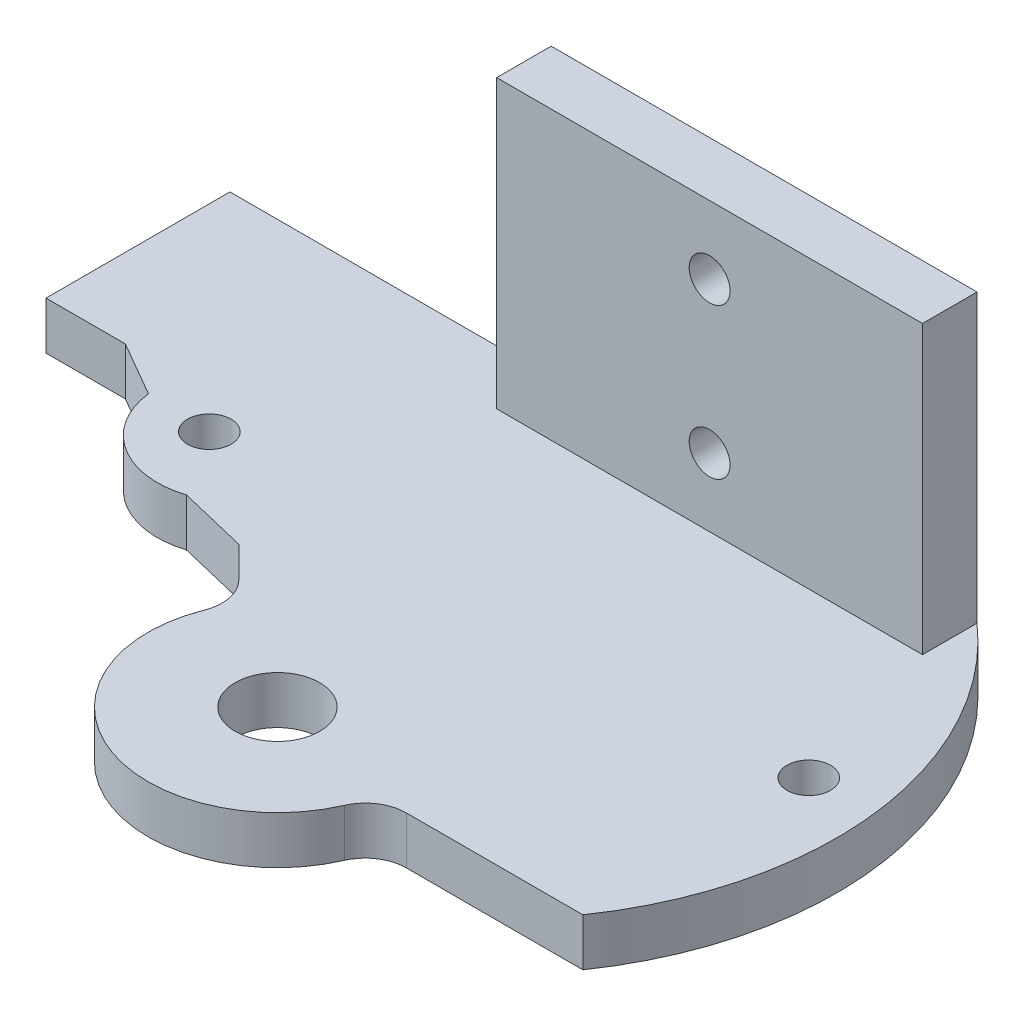
from build123d import *
from build123d.topology import SkipClean

# Parameters (mm, degrees)
CROQUIS1_W              = 70
CROQUIS1_H              = 65
EXTRUIR1_DEPTH          = 3.5
CROQUIS2_R              = 3.1
EXTRUIR2_DEPTH          = 5
EXTRUIR3_DEPTH          = 10
CROQUIS4_OUTSIDE_W      = 91.294
CROQUIS4_OUTSIDE_H      = 86.294
EXTRUIR4_DEPTH          = 10
REDONDEO1_R             = 3
EXTRUIR5_DEPTH          = 13.5
EXTRUIR6_DEPTH          = 3.5
CROQUIS7_R              = 1.6
EXTRUIR7_DEPTH          = 47.982330447
CROQUIS8_R              = 3.1
EXTRUIR8_DEPTH          = 5
CROQUIS9_W              = 0.7
CROQUIS9_H              = 10.5
EXTRUIR9_DEPTH          = 10
EXTRUIR10_DEPTH         = 63.752948337
EXTRUIR10_DEPTH_BACK    = 10
CROQUIS10_W             = 3.0625
CROQUIS10_H             = 5
CROQUIS11_W             = 54.8364
CROQUIS11_H             = 21.05596306
SALIENTE_EXTRUIR1_DEPTH = 4
CROQUIS15_W             = 23.581168674
CROQUIS15_H             = 21.05596306
CORTAR_EXTRUIR3_DEPTH   = 10
CROQUIS16_R             = 1.5
CORTAR_EXTRUIR4_DEPTH   = 10


with BuildPart() as part:
    # Croquis1 → Extruir1 (new body)
    with BuildSketch(Plane(origin=(0, 0, 0), x_dir=(1, 0, 0), z_dir=(0, 1, 0))):
        Rectangle(CROQUIS1_W, CROQUIS1_H)
    extrude(amount=EXTRUIR1_DEPTH)

    # Croquis2 → Extruir2 (cut)
    with BuildSketch(Plane(origin=(0, 3.5, 0), x_dir=(1, 0, 0), z_dir=(0, 1, 0))):
        with Locations(Location((0, -17.5, 0), (0, 0, 270))):
            Circle(CROQUIS2_R)
    extrude(amount=-EXTRUIR2_DEPTH, mode=Mode.SUBTRACT)

    # Croquis3 → Extruir3 (add)
    with BuildSketch(Plane(origin=(0, 3.5, 0), x_dir=(1, 0, 0), z_dir=(0, 1, 0))):
        with BuildLine():
            Line((-34.4868, 13.5), (20.3496, 13.5))
            Line((20.3496, 13.5), (20.3496, 0))
            Line((20.3496, 0), (17.146428199, 0))
            ThreePointArc((17.146428199, 0), (22.955777517, -8.939493087), (24.418230894, -19.5))
            Line((24.418230894, -19.5), (9.287087811, -19.5))
            ThreePointArc((9.287087811, -19.5), (-3.635492607, -26.276855559), (-7.981176331, -12.347250794))
            Line((-7.981176331, -12.347250794), (-18.680510212, -1.647916913))
            ThreePointArc((-18.680510212, -1.647916913), (-17.932408832, -0.806327142), (-17.146428199, 0))
            Line((-17.146428199, 0), (-34.4868, 0))
            Line((-34.4868, 0), (-34.4868, 13.5))
        make_face()
        with BuildLine():
            Line((-32.9868, 1.5), (-12.961481397, 1.5))
            ThreePointArc((-12.961481397, 1.5), (-14.868021343, 0.048274597), (-16.613165932, -1.593940849))
            Line((-16.613165932, -1.593940849), (-5.999348286, -12.207758495))
            ThreePointArc((-5.999348286, -12.207758495), (-3.061467459, -24.89103626), (7.984359711, -18))
            Line((7.984359711, -18), (22.994564575, -18))
            ThreePointArc((22.994564575, -18), (20.451694563, -6.977253708), (12.961481397, 1.5))
            Line((12.961481397, 1.5), (18.8496, 1.5))
            Line((18.8496, 1.5), (18.8496, 12))
            Line((18.8496, 12), (-32.9868, 12))
            Line((-32.9868, 12), (-32.9868, 1.5))
        make_face(mode=Mode.SUBTRACT)
    extrude(amount=EXTRUIR3_DEPTH)

    # Croquis4 outside → Extruir4 (cut)
    with SkipClean():  # the faces are left unmerged after this step: merging them gives an invalid solid
        with BuildSketch(Plane(origin=(0, 3.5, 0), x_dir=(1, 0, 0), z_dir=(0, 1, 0))):
            Rectangle(CROQUIS4_OUTSIDE_W, CROQUIS4_OUTSIDE_H)
            with BuildLine():
                Line((-34.4868, 0), (-17.146428199, 0))
                ThreePointArc((-17.146428199, 0), (-17.932408832, -0.806327142), (-18.680510212, -1.647916913))
                Line((-18.680510212, -1.647916913), (-7.981176331, -12.347250794))
                ThreePointArc((-7.981176331, -12.347250794), (-3.635492607, -26.276855559), (9.287087811, -19.5))
                Line((9.287087811, -19.5), (24.418230894, -19.5))
                ThreePointArc((24.418230894, -19.5), (22.955777517, -8.939493087), (17.146428199, 0))
                Line((17.146428199, 0), (20.3496, 0))
                Line((20.3496, 0), (20.3496, 13.5))
                Line((20.3496, 13.5), (-34.4868, 13.5))
                Line((-34.4868, 13.5), (-34.4868, 0))
            make_face(mode=Mode.SUBTRACT)
        extrude(amount=-EXTRUIR4_DEPTH, mode=Mode.SUBTRACT)

    # Redondeo1
    redondeo1_edges = [part.edges().sort_by_distance(p)[0] for p in [
        (-7.981176331, 8.5, 12.347250794),
        (9.287087811, 8.5, 19.5),
        (-5.999348286, 8.5, 12.207758495),
        (7.984359711, 8.5, 18),
    ]]
    fillet(redondeo1_edges, radius=REDONDEO1_R)

    # Croquis5 → Extruir5 (add)
    with SkipClean():  # the faces are left unmerged after this step: merging them gives an invalid solid
        with BuildSketch(Plane.XZ):
            with BuildLine():
                Line((-18.680510212, 1.647916913), (-14.437869525, 5.8905576))
                ThreePointArc((-14.437869525, 5.8905576), (-21.723092903, 6.819250451), (-24.449770984, 0))
                Line((-24.449770984, 0), (-17.146428199, 0))
                ThreePointArc((-17.146428199, 0), (-17.932408832, 0.806327142), (-18.680510212, 1.647916913))
            make_face()
            with BuildLine():
                Line((20.3496, 0), (20.3496, -13.5))
                ThreePointArc((20.3496, -13.5), (28.665212431, 2.225567304), (24.418230894, 19.5))
                ThreePointArc((24.418230894, 19.5), (22.955777517, 8.939493087), (17.146428199, 0))
                Line((17.146428199, 0), (20.3496, 0))
            make_face()
        extrude(amount=-EXTRUIR5_DEPTH)

    # Chaflán1
    # the kernel refuses this chamfer: 5, 4.044665138 mm, written as the material it adds along each edge
    with BuildSketch(Plane(origin=(-14.437869525, 3.5, 5.8905576), x_dir=(-0.8768595348589333, 0, 0.4807466652270976), z_dir=(0, 1, 0))) as chafl_n1_piece_1:
        with BuildLine():
            Line((2.949791971, 0), (-1.211824758, 3.780414953))
            Line((-1.211824758, 3.780414953), (-1.307822013, 3.752405544))
            ThreePointArc((-1.307822013, 3.752405544), (-0.651776703, 1.876825504), (-0.095997255, -0.02800941))
            Line((-0.095997255, -0.02800941), (0.02800941, -0.095997255))
            ThreePointArc((0.02800941, -0.095997255), (1.47002525, 0.136406993), (2.931105495, -0.098238565))
            Line((2.931105495, -0.098238565), (2.949791971, 0))
        make_face()
    extrude(amount=10)
    with BuildSketch(Plane(origin=(-24.449770984, 3.5, 0), x_dir=(-0.008036803743584595, 0, 0.9999677043712897), z_dir=(0, 1, 0))) as chafl_n1_piece_2:
        with BuildLine():
            Line((2.423263449, 0), (-0.064845869, -4.38542071))
            Line((-0.064845869, -4.38542071), (-0.164842639, -4.386224391))
            ThreePointArc((-0.164842639, -4.386224391), (-0.082377051, -2.193111839), (-0.09999677, -0.00080368))
            Line((-0.09999677, -0.00080368), (0.026691621, 0.096371974))
            ThreePointArc((0.026691621, 0.096371974), (1.204598314, -0.104316531), (2.411212242, 0.099271186))
            Line((2.411212242, 0.099271186), (2.423263449, 0))
        make_face()
    extrude(amount=10)
    with BuildSketch(Plane(origin=(-24.449770984, 0, 0), x_dir=(-0.9997395779240649, 0, -0.022820524363231526), z_dir=(0, 1, 0))) as chafl_n1_piece_3:
        with BuildLine():
            Line((4.385900112, 0), (-0.035828136, 2.422998574))
            Line((-0.035828136, 2.422998574), (-0.134910293, 2.409480951))
            ThreePointArc((-0.134910293, 2.409480951), (0.08649505, 1.206008973), (-0.096756078, 0.025263837))
            Line((-0.096756078, 0.025263837), (0.002282052, -0.099973958))
            ThreePointArc((0.002282052, -0.099973958), (2.194090072, -0.04994272), (4.388182164, -0.099973958))
            Line((4.388182164, -0.099973958), (4.385900112, 0))
        make_face()
    extrude(amount=3.5)
    with BuildSketch(Plane(origin=(-14.437869525, 0, 5.8905576), x_dir=(0.7254657554746632, 0, 0.6882582637597433), z_dir=(0, 1, 0))) as chafl_n1_piece_4:
        with BuildLine():
            Line((3.96989376, 0), (-0.900434913, -2.809001538))
            Line((-0.900434913, -2.809001538), (-0.98828054, -2.761219262))
            ThreePointArc((-0.98828054, -2.761219262), (-0.318834214, -1.441501248), (-0.099965384, 0.002630967))
            Line((-0.099965384, 0.002630967), (0.002630967, 0.099965384))
            ThreePointArc((0.002630967, 0.099965384), (1.986203869, 0.047760165), (3.972524727, 0.099965384))
            Line((3.972524727, 0.099965384), (3.96989376, 0))
        make_face()
    extrude(amount=3.5)


with BuildPart() as body_2:
    # Croquis6 → Extruir6 (new body)
    with BuildSketch(Plane(origin=(0, 13.5, 0), x_dir=(1, 0, 0), z_dir=(0, 1, 0))):
        with BuildLine():
            Line((-34.4868, 13.5), (-34.4868, 0))
            Line((-34.4868, 0), (-28.661374979, 0))
            Line((-28.661374979, 0), (-24.642400208, -2.323096648))
            ThreePointArc((-24.642400208, -2.323096648), (-21.929637735, -6.692039268), (-16.829963308, -7.355409896))
            Line((-16.829963308, -7.355409896), (-11.752306982, -8.576120143))
            Line((-11.752306982, -8.576120143), (-9.515139435, -10.813287689))
            ThreePointArc((-9.515139435, -10.813287689), (-8.69974084, -12.321679102), (-8.843709432, -14.030302105))
            ThreePointArc((-8.843709432, -14.030302105), (-3.635492607, -26.276855559), (8.70689382, -21.3))
            ThreePointArc((8.70689382, -21.3), (9.813271565, -19.99001992), (11.456439237, -19.5))
            Line((11.456439237, -19.5), (24.418230894, -19.5))
            ThreePointArc((24.418230894, -19.5), (28.665212431, -2.225567304), (20.3496, 13.5))
            Line((20.3496, 13.5), (-34.4868, 13.5))
        make_face()
    extrude(amount=EXTRUIR6_DEPTH)


with BuildPart() as extruir7_tool:
    # Croquis7 → Extruir7 (new, through all)
    with BuildSketch(Plane(origin=(0, 17, 0), x_dir=(1, 0, 0), z_dir=(0, 1, 0))):
        with Locations(Location((-20, -2.5, 0), (0, 0, 270))):
            Circle(CROQUIS7_R)
        with Locations(Location((24, -2.5, 0), (0, 0, 270))):
            Circle(CROQUIS7_R)
    extrude(amount=-EXTRUIR7_DEPTH)


with BuildPart() as part_1:
    add(part.part)

    # Extruir7: cut by extruir7_tool
    add(extruir7_tool.part, mode=Mode.SUBTRACT)

    # Croquis9 → Extruir9 (cut)
    with BuildSketch(Plane(origin=(0, 13.5, 0), x_dir=(1, 0, 0), z_dir=(0, 1, 0))):
        with Locations((19.1996, 6.75)):
            Rectangle(CROQUIS9_W, CROQUIS9_H)
    extrude(amount=-EXTRUIR9_DEPTH, mode=Mode.SUBTRACT)

    # Croquis10 → Extruir10 (cut, two sides: drawn at the far end of the back side and taken through both)
    with BuildSketch(Plane.ZY.offset(-19.5496).offset(-EXTRUIR10_DEPTH_BACK)):
        with Locations((-8.9375, 8.5)):
            Rectangle(CROQUIS10_W, CROQUIS10_H)
    extrude(amount=EXTRUIR10_DEPTH + EXTRUIR10_DEPTH_BACK, mode=Mode.SUBTRACT)


with BuildPart() as body_2_1:
    add(body_2.part)

    # Extruir7: cut by extruir7_tool
    add(extruir7_tool.part, mode=Mode.SUBTRACT)

    # Croquis8 → Extruir8 (cut)
    with BuildSketch(Plane(origin=(0, 17, 0), x_dir=(1, 0, 0), z_dir=(0, 1, 0))):
        with Locations(Location((0, -17.5, 0), (0, 0, 270))):
            Circle(CROQUIS8_R)
    extrude(amount=-EXTRUIR8_DEPTH, mode=Mode.SUBTRACT)

    # Croquis11 → Saliente-Extruir1 (add)
    with BuildSketch(Plane(origin=(0, 0, -13.5), x_dir=(-1, 0, 0), z_dir=(0, 0, -1))):
        with Locations((7.0686, 27.52798153)):
            Rectangle(CROQUIS11_W, CROQUIS11_H)
    extrude(amount=-SALIENTE_EXTRUIR1_DEPTH)

    # Croquis15 → Cortar-Extruir3 (cut)
    with BuildSketch(Plane.XY.offset(-9.5)):
        with Locations((-22.696215663, 27.52798153)):
            Rectangle(CROQUIS15_W, CROQUIS15_H)
    extrude(amount=-CORTAR_EXTRUIR3_DEPTH, mode=Mode.SUBTRACT)

    # Croquis16 → Cortar-Extruir4 (cut)
    with BuildSketch(Plane.XY.offset(-9.5)):
        with Locations((4.721984337, 33.05596306)):
            Circle(CROQUIS16_R)
        with Locations((4.721984337, 22)):
            Circle(CROQUIS16_R)
    extrude(amount=-CORTAR_EXTRUIR4_DEPTH, mode=Mode.SUBTRACT)


solid = body_2_1.part
